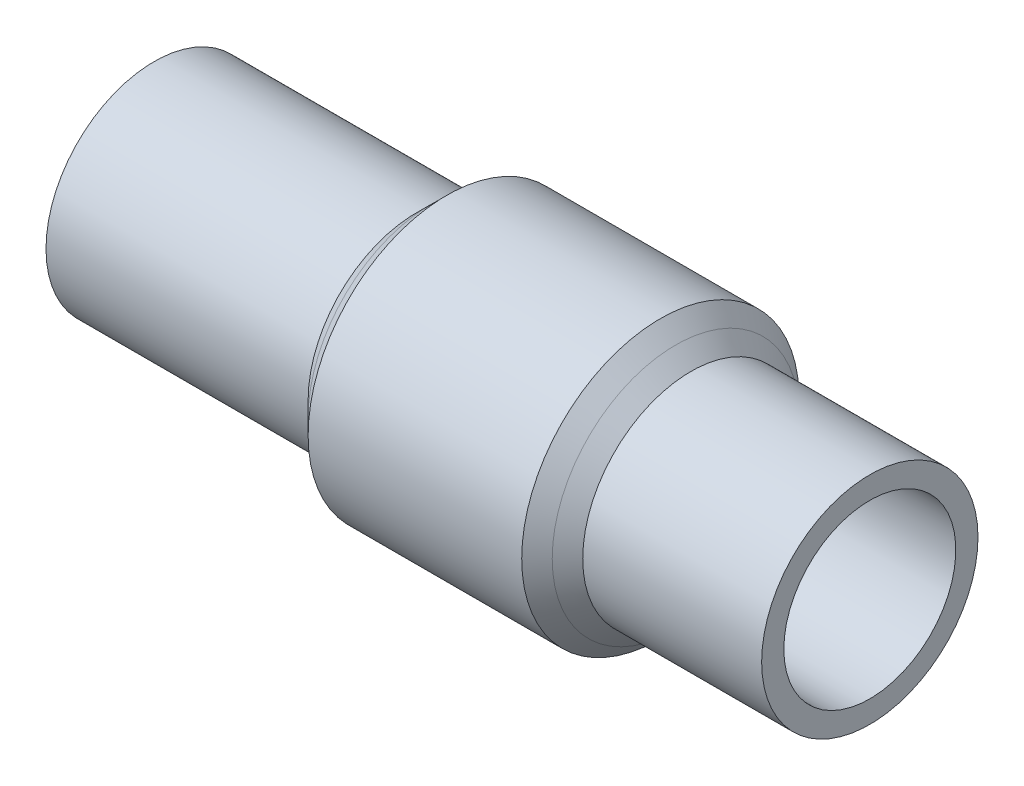
from build123d import *

# Parameters (mm, degrees)
CHAMFER8_SIZE       = 0.55
BOSS_EXTRUDE3_START = 3
SKETCH8_R           = 3.9
BOSS_EXTRUDE3_DEPTH = 3


with BuildPart() as part:
    # Sketch1 → Revolve1 (revolve)
    with BuildSketch(Plane(origin=(0, 0, 0), x_dir=(1, 0, 0), z_dir=(0, 1, 0)), mode=Mode.PRIVATE) as revolve1_sk:
        Polygon((-11.4, 3.1), (11.4, 3.1), (11.4, 3.9), (4.4, 3.9), (4.4, 5), (-4.4, 5), (-4.4, 3.9), (-11.4, 3.9), align=None)
    revolve(revolve1_sk.sketch.rotate(Axis((-11.4, 0, 0), (1, 0, 0)), 180), axis=Axis((-11.4, 0, 0), (1, 0, 0)))

    # Chamfer8
    chamfer8_edges = [part.edges().sort_by_distance(p)[0] for p in [
        (4.4, 0, -3.9),
        (4.4, 0, -5),
        (-4.4, 0, -5),
        (-4.4, 0, -3.9),
    ]]
    chamfer(chamfer8_edges, length=CHAMFER8_SIZE - 0.0001)  # a hair under: the kernel refuses the full size

    # Sketch8 → Boss-Extrude3 (add)
    with BuildSketch(Plane.ZY.offset(11.4).offset(BOSS_EXTRUDE3_START)):
        Circle(SKETCH8_R)
    extrude(amount=-BOSS_EXTRUDE3_DEPTH)


solid = part.part
